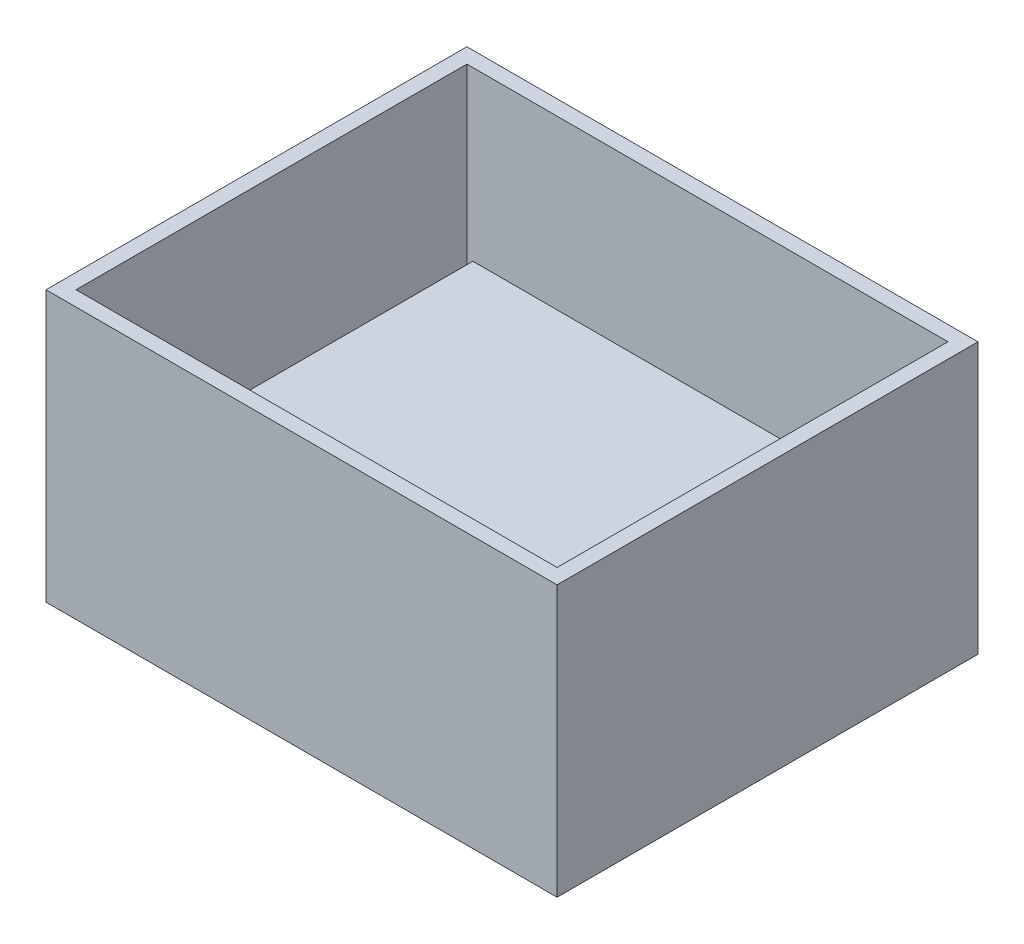
from build123d import *

# Parameters (mm, degrees)
ENCLOSURE_START     = 165
SKETCH1_W           = 70
SKETCH1_H           = 45
ENCLOSURE_DEPTH     = 85
CAVITY_START        = 167.5
SKETCH2_W           = 65
SKETCH2_H           = 47.5
CAVITY_DEPTH        = 80
ARDUINO_UNO_START   = 173
SKETCH3_W           = 53.4
SKETCH3_H           = 1.6
ARDUINO_UNO_DEPTH   = 68.6
SENSOR_SHIELD_START = 173
SKETCH4_W           = 53.4
SKETCH4_H           = 1.6
SENSOR_SHIELD_DEPTH = 68.6


with BuildPart() as part:
    # Sketch1 → enclosure (new body)
    with BuildSketch(Plane(origin=(0, 0, 0), x_dir=(0, 0, -1), z_dir=(1, 0, 0)).offset(ENCLOSURE_START)):
        with Locations((-80, 22.5)):
            Rectangle(SKETCH1_W, SKETCH1_H)
    extrude(amount=ENCLOSURE_DEPTH)


with BuildPart() as body_2:
    # Sketch2 → cavity (new body)
    with BuildSketch(Plane(origin=(0, 0, 0), x_dir=(0, 0, -1), z_dir=(1, 0, 0)).offset(CAVITY_START)):
        with Locations((-80, 26.25)):
            Rectangle(SKETCH2_W, SKETCH2_H)
    extrude(amount=CAVITY_DEPTH)


with BuildPart() as part_1:
    add(part.part)

    # Combine1: cut body 2
    add(body_2.part, mode=Mode.SUBTRACT)


with BuildPart() as body_2_2:
    # Sketch3 → arduino_uno (new body)
    with BuildSketch(Plane(origin=(0, 0, 0), x_dir=(0, 0, -1), z_dir=(1, 0, 0)).offset(ARDUINO_UNO_START)):
        with Locations((-78.7, 6.8)):
            Rectangle(SKETCH3_W, SKETCH3_H)
    extrude(amount=ARDUINO_UNO_DEPTH)


with BuildPart() as body_3:
    # Sketch4 → sensor_shield (new body)
    with BuildSketch(Plane(origin=(0, 0, 0), x_dir=(0, 0, -1), z_dir=(1, 0, 0)).offset(SENSOR_SHIELD_START)):
        with Locations((-78.7, 20.8)):
            Rectangle(SKETCH4_W, SKETCH4_H)
    extrude(amount=SENSOR_SHIELD_DEPTH)


solid = Compound([part_1.part, body_2_2.part, body_3.part])
